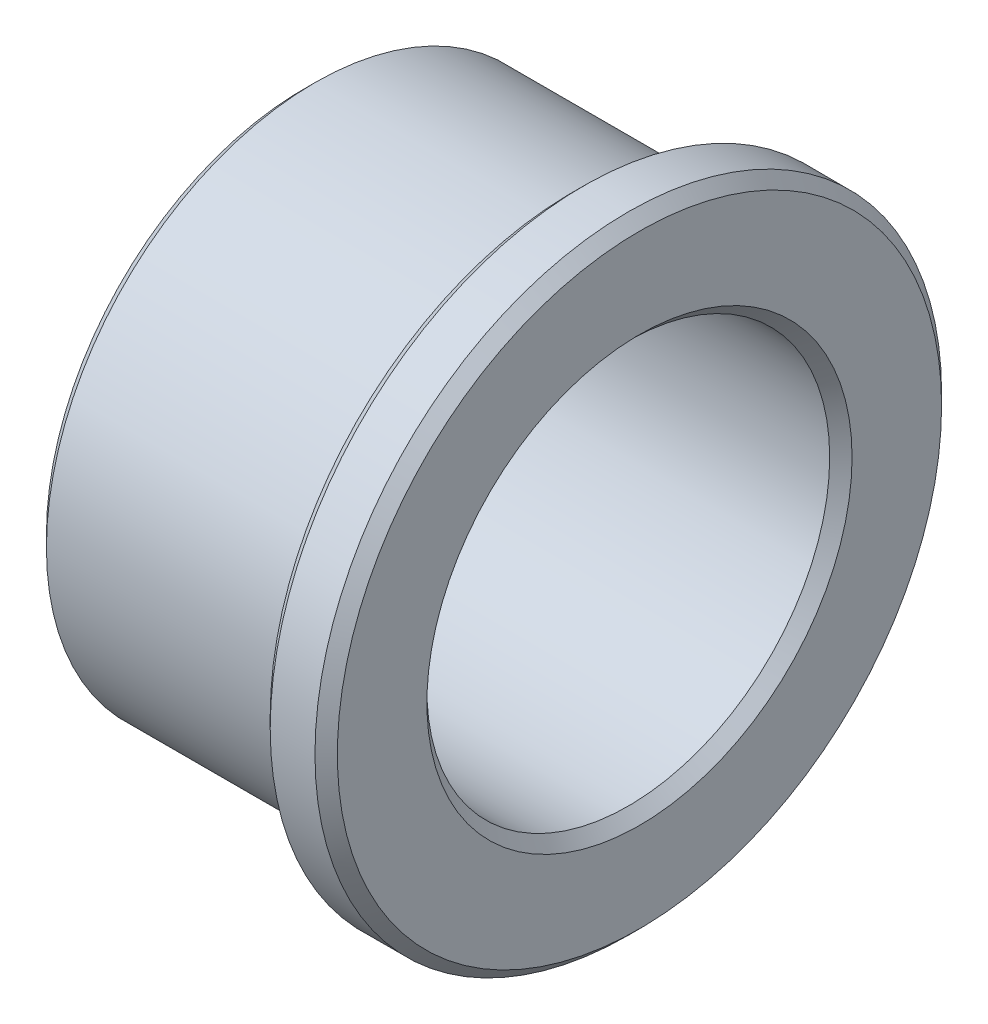
from build123d import *

# Parameters (mm, degrees)
SKETCH1_R           = 7
SKETCH1_R_2         = 4.5
BOSS_EXTRUDE1_DEPTH = 7.5
SKETCH2_OUTSIDE_W   = 20.234
SKETCH2_OUTSIDE_H   = 20.234
SKETCH2_OUTSIDE_R   = 6
CUT_EXTRUDE1_DEPTH  = 6
CHAMFER1_SIZE       = 0.25


with BuildPart() as part:
    # Sketch1 → Boss-Extrude1 (new body)
    with BuildSketch(Plane(origin=(0, 0, 0), x_dir=(0, 0, -1), z_dir=(1, 0, 0))):
        Circle(SKETCH1_R)
        Circle(SKETCH1_R_2, mode=Mode.SUBTRACT)
    extrude(amount=BOSS_EXTRUDE1_DEPTH)

    # Sketch2 outside → Cut-Extrude1 (cut)
    with BuildSketch(Plane.ZY):
        Rectangle(SKETCH2_OUTSIDE_W, SKETCH2_OUTSIDE_H)
        Circle(SKETCH2_OUTSIDE_R, mode=Mode.SUBTRACT)
    extrude(amount=-CUT_EXTRUDE1_DEPTH, mode=Mode.SUBTRACT)

    # Chamfer1
    chamfer1_edges = [part.edges().sort_by_distance(p)[0] for p in [
        (0, 0, 4.5),
        (7.5, 0, 7),
        (7.5, 0, 4.5),
        (0, 0, -6),
        (6, 0, 7),
    ]]
    chamfer(chamfer1_edges, length=CHAMFER1_SIZE)


solid = part.part
